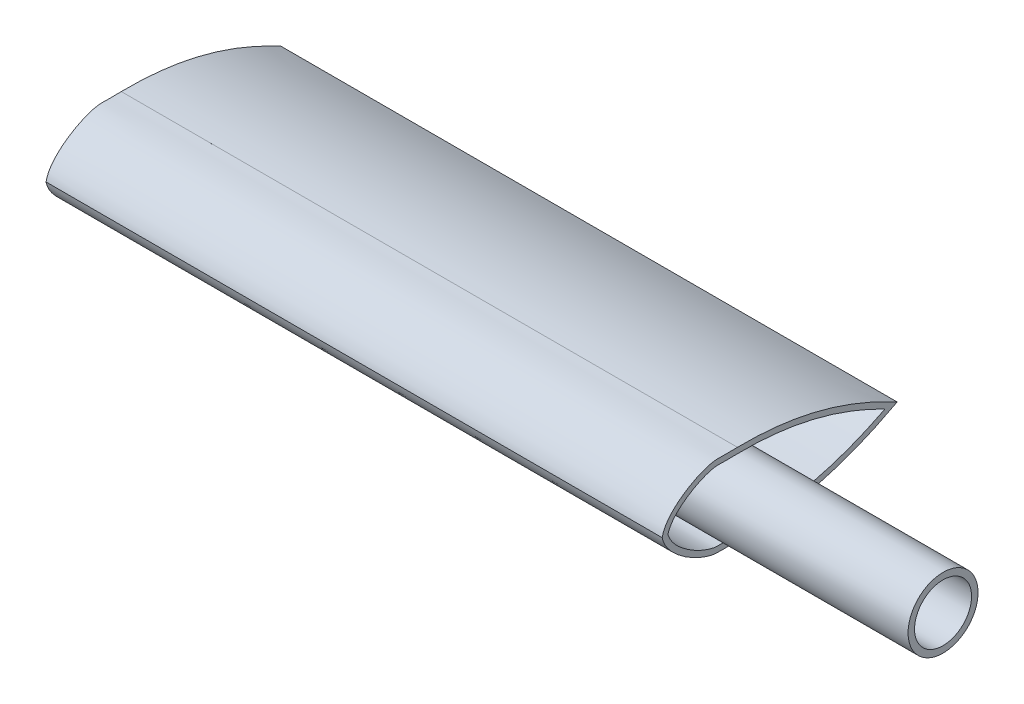
from build123d import *

# Parameters (mm, degrees)
BOSS_EXTRUDE1_DEPTH      = 98.610323
BOSS_EXTRUDE1_DEPTH_BACK = 87.674643
SKETCH1_R                = 7.9375
SKETCH1_R_2              = 6.4643
EXTRUDE_THIN1_START      = -139.7
EXTRUDE_THIN1_DEPTH      = 139.7


# Read off the part's stored shape, not the designer's step: Extrude-Thin1
with BuildPart() as part:
    # Sketch1 → Boss-Extrude1 (new, two sides: drawn at the far end of the back side and taken through both)
    with BuildSketch(Plane(origin=(0, 0, 0), x_dir=(0, 0, -1), z_dir=(1, 0, 0)).offset(-BOSS_EXTRUDE1_DEPTH_BACK)):
        with Locations(Location((0, 0, 0), (0, 0, 180))):
            Circle(SKETCH1_R)
        with Locations(Location((0, 0, 0), (0, 0, 180))):
            Circle(SKETCH1_R_2, mode=Mode.SUBTRACT)
    extrude(amount=BOSS_EXTRUDE1_DEPTH + BOSS_EXTRUDE1_DEPTH_BACK)


with BuildPart() as body_2:
    # Extrude-Thin1 outline → Extrude-Thin1 (new body)
    with BuildSketch(Plane.ZY.offset(87.674642954).offset(EXTRUDE_THIN1_START)):
        with BuildLine():
            add(Edge.make_bspline(
                [(17.102094562, 0), (17.04739702, 0.213797016), (16.995336819, 0.42880706), (16.862538118, 0.845636753), (16.785160791, 1.049002351), (16.524638716, 1.646041309), (16.313322861, 2.026757553), (15.952145288, 2.577500677), (15.823799266, 2.758298236), (15.55747882, 3.108894312), (15.419296606, 3.279121061), (14.991807723, 3.776732023), (14.689672994, 4.091162254), (14.058517718, 4.692872976), (13.729440661, 4.980096404), (13.048538768, 5.531572182), (12.695830839, 5.79630298), (11.621386484, 6.549823619), (10.879692917, 7.002537116), (9.350485078, 7.81841744), (8.563418356, 8.182458905), (7.337712392, 8.640371405), (6.920131838, 8.778488758), (6.068362945, 9.009083778), (5.641217648, 9.100109427), (4.782855054, 9.20377314), (4.351397815, 9.211792234), (3.486983413, 9.198956322), (3.054597909, 9.189105956), (1.758100925, 9.172251023), (0.894552451, 9.176084553), (0.032418914, 9.207156149)],
                knots=[0, 0, 0, 0, 0.03125, 0.03125, 0.0625, 0.0625, 0.125, 0.125, 0.15625, 0.15625, 0.1875, 0.1875, 0.25, 0.25, 0.3125, 0.3125, 0.375, 0.375, 0.5, 0.5, 0.625, 0.625, 0.6875, 0.6875, 0.75, 0.75, 0.8125, 0.8125, 0.875, 0.875, 1, 1, 1, 1], degree=3))
            add(Edge.make_bspline(
                [(0.032418914, 9.207156149), (-3.121526951, 9.254567879), (-6.268108602, 9.110594057), (-10.968108502, 8.569736414), (-12.52521706, 8.336275013), (-15.620025789, 7.761375356), (-17.159089419, 7.419573925), (-21.738086481, 6.234254823), (-24.724357097, 5.234488958), (-29.105751606, 3.451071682), (-30.544977721, 2.811540258), (-32.674611159, 1.79028171), (-33.379214501, 1.438672145), (-34.780824408, 0.719336072), (-35.481629362, 0.359668036), (-36.182434315, 0)],
                knots=[0, 0, 0, 0, 0.25, 0.25, 0.375, 0.375, 0.5, 0.5, 0.75, 0.75, 0.875, 0.875, 0.9375, 0.9375, 1, 1, 1, 1], degree=3))
            add(Edge.make_bspline(
                [(-36.182434315, 0), (-35.481521346, -0.359723472), (-34.780608377, -0.719446944), (-33.378782439, -1.438893888), (-32.674037428, -1.790565857), (-30.54384954, -2.812063227), (-29.103490823, -3.452048995), (-26.182421908, -4.640936279), (-24.705875102, -5.18815569), (-21.718958236, -6.182841679), (-20.207183631, -6.630656344), (-15.628240433, -7.815624895), (-12.531730425, -8.389928975), (-6.265599348, -9.11075463), (-3.121472775, -9.254567065), (0.032418914, -9.207156149)],
                knots=[0, 0, 0, 0, 0.0625, 0.0625, 0.125, 0.125, 0.25, 0.25, 0.375, 0.375, 0.5, 0.5, 0.75, 0.75, 1, 1, 1, 1], degree=3))
            add(Edge.make_bspline(
                [(0.032418914, -9.207156149), (0.905514517, -9.175689476), (1.779125635, -9.172233827), (3.089959502, -9.189718729), (3.526990194, -9.200223759), (4.400877656, -9.211783508), (4.837511077, -9.200702397), (5.491209368, -9.116060671), (5.709156111, -9.077545633), (6.137233482, -8.98673913), (6.348502946, -8.934293247), (6.975926684, -8.760718275), (7.385801524, -8.623619453), (8.597622689, -8.167045839), (9.38212336, -7.803203601), (10.531369419, -7.187490205), (10.910587265, -6.969553739), (11.651698354, -6.513571235), (12.014278322, -6.275223658), (13.076641296, -5.527228859), (13.752024112, -4.98589787), (14.696235941, -4.084483233), (15.000618027, -3.767120438), (15.567824422, -3.105568901), (15.83163431, -2.760825125), (16.188955162, -2.216615083), (16.301620626, -2.030666021), (16.511878279, -1.648130786), (16.609863922, -1.450611941), (16.785610923, -1.048088593), (16.863353526, -0.843382437), (16.996060883, -0.426225712), (17.047692544, -0.212641899), (17.102094562, 0)],
                knots=[0, 0, 0, 0, 0.125, 0.125, 0.1875, 0.1875, 0.25, 0.25, 0.28125, 0.28125, 0.3125, 0.3125, 0.375, 0.375, 0.5, 0.5, 0.5625, 0.5625, 0.625, 0.625, 0.75, 0.75, 0.8125, 0.8125, 0.875, 0.875, 0.90625, 0.90625, 0.9375, 0.9375, 0.96875, 0.96875, 1, 1, 1, 1], degree=3))
        make_face()
        with BuildLine():
            add(Edge.make_bspline(
                [(0, 7.9375), (-11.980740822, 8.117600633), (-22.750058366, 5.466290217), (-33.401, 0)],
                knots=[0, 0, 0, 0, 1, 1, 1, 1], degree=3))
            add(Edge.make_bspline(
                [(15.791190362, 0), (14.817942328, 3.804147623), (7.441618018, 7.989029069), (3.229273207, 7.925930538), (1.470189631, 7.884513847), (0, 7.9375)],
                knots=[0, 0, 0, 0, 0.663308265, 0.763308265, 1, 1, 1, 1], degree=3))
            add(Edge.make_bspline(
                [(0, -7.9375), (1.470189631, -7.884513847), (3.229273207, -7.925930538), (7.441618018, -7.989029069), (14.817942328, -3.804147623), (15.791190362, 0)],
                knots=[0, 0, 0, 0, 0.236691735, 0.336691735, 1, 1, 1, 1], degree=3))
            add(Edge.make_bspline(
                [(-33.401, 0), (-22.750058366, -5.466290217), (-11.980740822, -8.117600633), (0, -7.9375)],
                knots=[0, 0, 0, 0, 1, 1, 1, 1], degree=3))
        make_face(mode=Mode.SUBTRACT)
    extrude(amount=EXTRUDE_THIN1_DEPTH)


solid = Compound([part.part, body_2.part])
